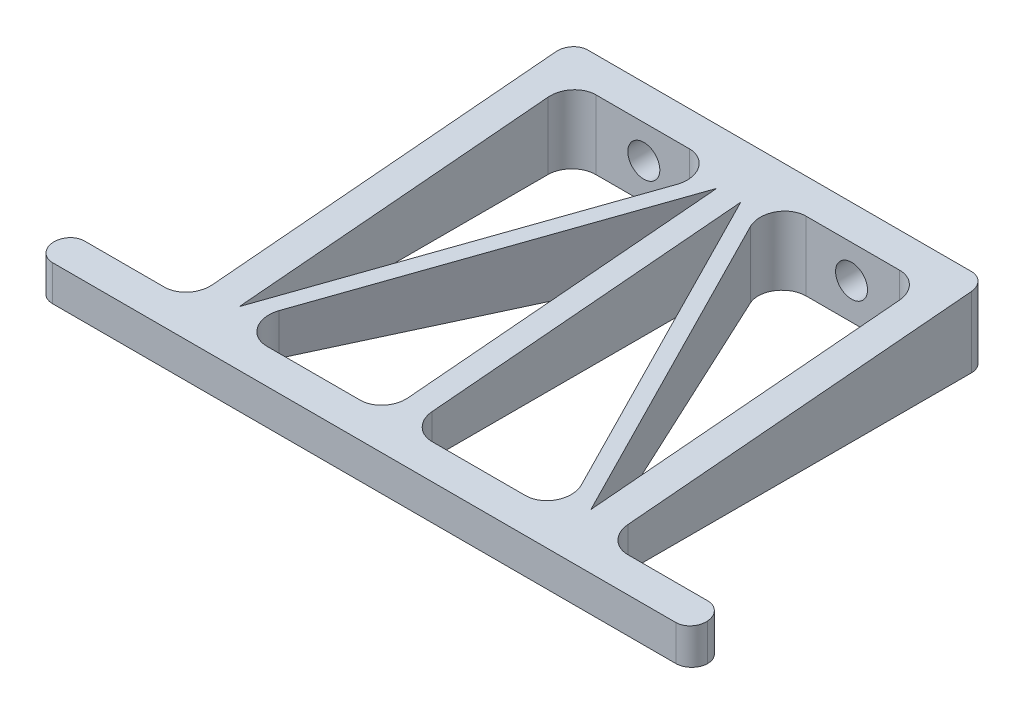
from build123d import *

# Parameters (mm, degrees)
BOSS_EXTRUDE1_DEPTH = 9
FILLET1_R           = 3
FILLET2_R           = 2
CUT_EXTRUDE1_REACH  = 68.828
SKETCH2_R           = 2
DRAFT1_START        = 6.699702971
DRAFT1_OUTLINE_W    = 84
DRAFT1_OUTLINE_H    = 55
DRAFT1_DEPTH        = 4.532098623


# Read off the part's stored shape, not the designer's step: Draft1
with BuildPart() as part:
    # Sketch1 → Boss-Extrude1 (new body)
    # profile 1 of 4: a face of its own
    with BuildSketch(Plane(origin=(0, 0, 0), x_dir=(1, 0, 0), z_dir=(0, 1, 0))):
        Polygon((26, 26), (-26, 26), (-26, -22), (-41, -22), (-41, -26), (-26, -26), (26, -26), (41, -26), (41, -22), (26, -22), align=None)
        Polygon((-22, -19.632135629), (-22, 22), (-2.603209536, 22), (-1.5, 22), (-1.5, 19.632135629), (-1.5, -22), (-20.896790464, -22), (-22, -22), align=None, mode=Mode.SUBTRACT)
        Polygon((1.5, 19.632135629), (1.5, 22), (2.603209536, 22), (22, 22), (22, -19.632135629), (22, -22), (20.896790464, -22), (1.5, -22), align=None, mode=Mode.SUBTRACT)
    # profile 2 of 4: a face of its own
    with BuildSketch(Plane(origin=(0, 0, 0), x_dir=(1, 0, 0), z_dir=(0, 1, 0))):
        Polygon((26, 26), (-26, 26), (-26, -22), (-41, -22), (-41, -26), (-26, -26), (26, -26), (41, -26), (41, -22), (26, -22), align=None)
        Polygon((-22, -19.632135629), (-22, 22), (-2.603209536, 22), (-1.5, 22), (-1.5, 19.632135629), (-1.5, -22), (-20.896790464, -22), (-22, -22), align=None, mode=Mode.SUBTRACT)
        Polygon((1.5, 19.632135629), (1.5, 22), (2.603209536, 22), (22, 22), (22, -19.632135629), (22, -22), (20.896790464, -22), (1.5, -22), align=None, mode=Mode.SUBTRACT)
    # profile 3 of 4: a face of its own
    with BuildSketch(Plane(origin=(0, 0, 0), x_dir=(1, 0, 0), z_dir=(0, 1, 0))):
        Polygon((-1.5, 22), (-2.603209536, 22), (-22, -19.632135629), (-22, -22), (-20.896790464, -22), (-1.5, 19.632135629), align=None)
    # profile 4 of 4: a face of its own
    with BuildSketch(Plane(origin=(0, 0, 0), x_dir=(1, 0, 0), z_dir=(0, 1, 0))):
        Polygon((2.603209536, 22), (1.5, 22), (1.5, 19.632135629), (20.896790464, -22), (22, -22), (22, -19.632135629), align=None)
    extrude(amount=BOSS_EXTRUDE1_DEPTH)

    # Fillet1
    fillet1_edges = [part.edges().sort_by_distance(p)[0] for p in [
        (-26, 4.5, 22),
        (26, 4.5, 22),
        (22, 4.5, -22),
        (2.603209536, 4.5, -22),
        (-2.603209536, 4.5, -22),
        (-22, 4.5, -22),
        (20.896790464, 4.5, 22),
        (1.5, 4.5, 22),
        (-20.896790464, 4.5, 22),
        (-1.5, 4.5, 22),
    ]]
    fillet(fillet1_edges, radius=FILLET1_R)

    # Fillet2
    fillet2_edges = [part.edges().sort_by_distance(p)[0] for p in [
        (-26, 4.5, -26),
        (26, 4.5, -26),
        (41, 4.5, 26),
        (41, 4.5, 22),
        (-41, 4.5, 22),
        (-41, 4.5, 26),
    ]]
    fillet(fillet2_edges, radius=FILLET2_R - 0.0001)  # a hair under: the kernel refuses the full size

    # Sketch2 → Cut-Extrude1 (cut, up to next)
    with BuildSketch(Plane(origin=(0, 0, -26), x_dir=(-1, 0, 0), z_dir=(0, 0, -1)), mode=Mode.PRIVATE) as cut_extrude1_sk1:
        with Locations((-13, 4.5)):
            Circle(SKETCH2_R)
    cut_extrude1_tool1 = extrude(cut_extrude1_sk1.sketch, amount=-CUT_EXTRUDE1_REACH, mode=Mode.PRIVATE) & part.part
    # Sketch2 → Cut-Extrude1 (cut, up to next)
    with BuildSketch(Plane(origin=(0, 0, -26), x_dir=(-1, 0, 0), z_dir=(0, 0, -1)), mode=Mode.PRIVATE) as cut_extrude1_sk2:
        with Locations((13, 4.5)):
            Circle(SKETCH2_R)
    cut_extrude1_tool2 = extrude(cut_extrude1_sk2.sketch, amount=-CUT_EXTRUDE1_REACH, mode=Mode.PRIVATE) & part.part
    add(cut_extrude1_tool1.solids().sort_by_distance((13, 4.5, -26))[0], mode=Mode.SUBTRACT)
    add(cut_extrude1_tool2.solids().sort_by_distance((-13, 4.5, -26))[0], mode=Mode.SUBTRACT)

    # Draft1 outline → Draft1 (cut)
    with BuildSketch(Plane(origin=(0, 0, 0), x_dir=(1, 0, 0), z_dir=(0, 0.9961946980917455, 0.08715574274765815)).offset(DRAFT1_START)):
        with Locations((0, 0.5)):
            Rectangle(DRAFT1_OUTLINE_W, DRAFT1_OUTLINE_H)
    extrude(amount=DRAFT1_DEPTH, mode=Mode.SUBTRACT)


solid = part.part
